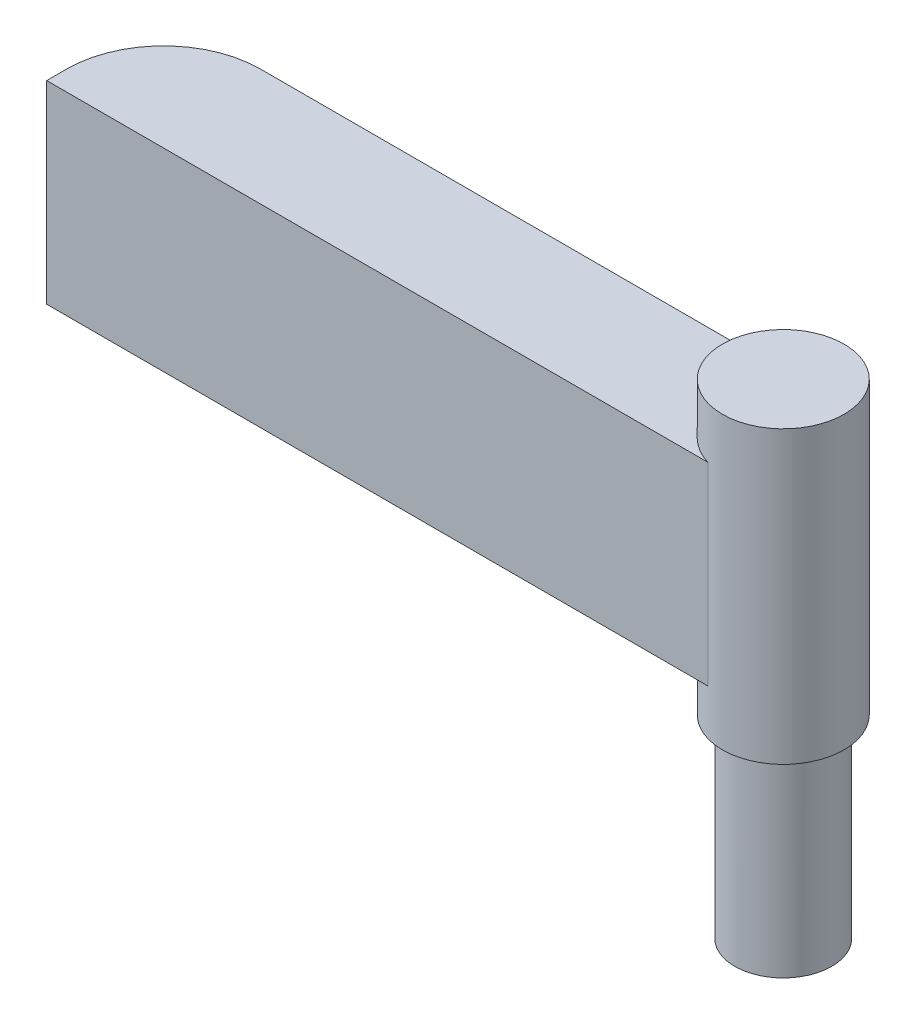
from build123d import *

# Parameters (mm, degrees)
SKETCH5_R           = 0.5
BOSS_EXTRUDE2_DEPTH = 2
SKETCH8_R           = 0.627946769
BOSS_EXTRUDE4_DEPTH = 3
SKETCH11_W          = 1.206172966
SKETCH11_H          = 2
BOSS_EXTRUDE5_DEPTH = 7
FILLET1_R           = 1


with BuildPart() as part:
    # Sketch5 → Boss-Extrude2 (new body)
    with BuildSketch(Plane.XZ.offset(-9.339266183)):
        Circle(SKETCH5_R)
    extrude(amount=-BOSS_EXTRUDE2_DEPTH)

    # Sketch8 → Boss-Extrude4 (add)
    with BuildSketch(Plane(origin=(0, 11.339266183, 0), x_dir=(1, 0, 0), z_dir=(0, 1, 0))):
        Circle(SKETCH8_R)
    extrude(amount=BOSS_EXTRUDE4_DEPTH)

    # Sketch11 → Boss-Extrude5 (add)
    with BuildSketch(Plane(origin=(0, 0, 0), x_dir=(0, 0, -1), z_dir=(1, 0, 0))):
        with Locations((0, 12.810409413)):
            Rectangle(SKETCH11_W, SKETCH11_H)
    extrude(amount=-BOSS_EXTRUDE5_DEPTH)

    # Fillet1
    fillet1_edges = [part.edges().sort_by_distance(p)[0] for p in [
        (-7, 12.810409413, -0.603086483),
    ]]
    fillet(fillet1_edges, radius=FILLET1_R)


solid = part.part
